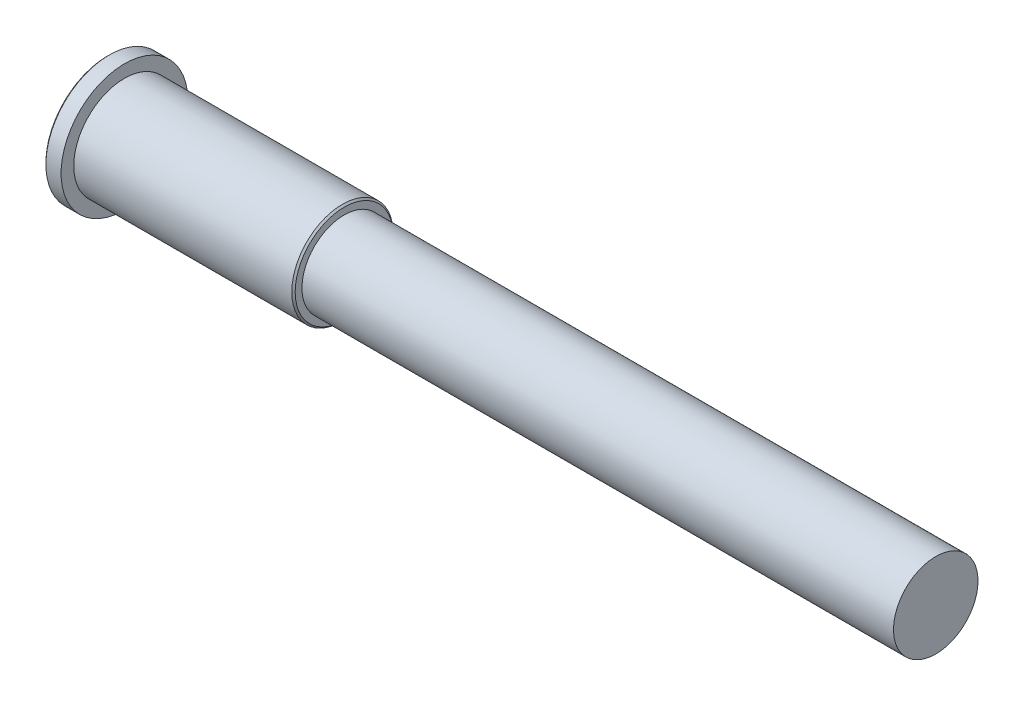
from build123d import *

# Parameters (mm, degrees)
SKETCH1_R           = 7.5
BOSS_EXTRUDE1_DEPTH = 2
SKETCH2_R           = 6
BOSS_EXTRUDE2_DEPTH = 26
SKETCH3_R           = 5
BOSS_EXTRUDE3_DEPTH = 70
CHAMFER1_SIZE       = 0.2


with BuildPart() as part:
    # Sketch1 → Boss-Extrude1 (new body)
    with BuildSketch(Plane(origin=(0, 0, 0), x_dir=(0, 0, -1), z_dir=(1, 0, 0))):
        Circle(SKETCH1_R)
    extrude(amount=BOSS_EXTRUDE1_DEPTH)

    # Sketch2 → Boss-Extrude2 (add)
    with BuildSketch(Plane(origin=(2, 0, 0), x_dir=(0, 0, -1), z_dir=(1, 0, 0))):
        Circle(SKETCH2_R)
    extrude(amount=BOSS_EXTRUDE2_DEPTH)

    # Sketch3 → Boss-Extrude3 (add)
    with BuildSketch(Plane(origin=(28, 0, 0), x_dir=(0, 0, -1), z_dir=(1, 0, 0))):
        Circle(SKETCH3_R)
    extrude(amount=BOSS_EXTRUDE3_DEPTH)

    # Chamfer1
    chamfer1_edges = [part.edges().sort_by_distance(p)[0] for p in [
        (0, 0, 7.5),
        (28, 0, 6),
    ]]
    chamfer(chamfer1_edges, length=CHAMFER1_SIZE)


solid = part.part
